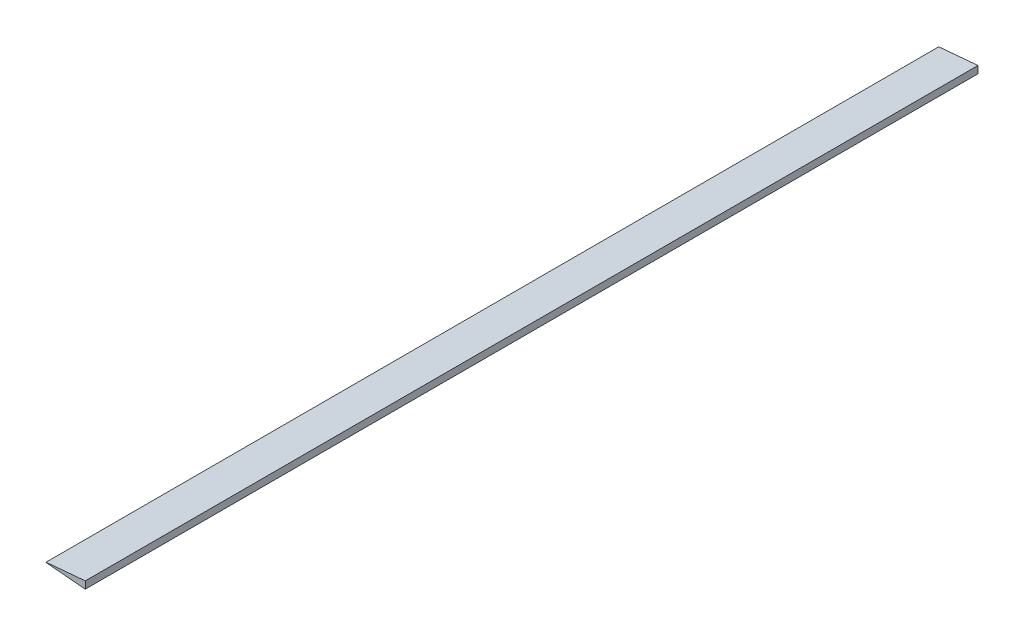
from build123d import *

# Parameters (mm, degrees)
BOSS_EXTRUDE1_DEPTH = 422.9


with BuildPart() as part:
    # Sketch1 → Boss-Extrude1 (new, symmetric)
    with BuildSketch(Plane.XY):
        with BuildLine():
            Line((-86.8182, 3.407133977), (-86.8182, -3.407133977))
            add(Edge.make_bspline(
                [(-86.8182, -3.407133977), (-86.957454695, -3.397308094), (-89.025279509, -3.251401314), (-92.907115627, -2.950780703), (-98.331146339, -2.517743017), (-103.357060837, -2.092543961), (-107.930049199, -1.688344559), (-111.999942548, -1.313562985), (-115.52216522, -0.977424524), (-118.458129226, -0.688450107), (-120.775680277, -0.454472386), (-122.449436434, -0.282121682), (-123.461079815, -0.176589872), (-123.91276289, -0.129108234), (-124.026, -0.11720457)],
                knots=[0, 0, 0, 0, 0.011211572, 0.166483201, 0.31268616, 0.448210553, 0.571562716, 0.681381362, 0.776452467, 0.855722863, 0.918312437, 0.963524724, 0.990855635, 1, 1, 1, 1], degree=3))
            Line((-124.026, -0.11720457), (-124.026, 0.11720457))
            add(Edge.make_bspline(
                [(-86.8182, 3.407133977), (-86.957454695, 3.397308094), (-89.025279509, 3.251401314), (-92.907115627, 2.950780703), (-98.331146339, 2.517743017), (-103.357060837, 2.092543961), (-107.930049199, 1.688344559), (-111.999942548, 1.313562985), (-115.52216522, 0.977424524), (-118.458129226, 0.688450107), (-120.775680277, 0.454472386), (-122.449436434, 0.282121682), (-123.461079815, 0.176589872), (-123.91276289, 0.129108234), (-124.026, 0.11720457)],
                knots=[0, 0, 0, 0, 0.011211572, 0.166483201, 0.31268616, 0.448210553, 0.571562716, 0.681381362, 0.776452467, 0.855722863, 0.918312437, 0.963524724, 0.990855635, 1, 1, 1, 1], degree=3))
        make_face()
    extrude(amount=BOSS_EXTRUDE1_DEPTH, both=True)


solid = part.part
